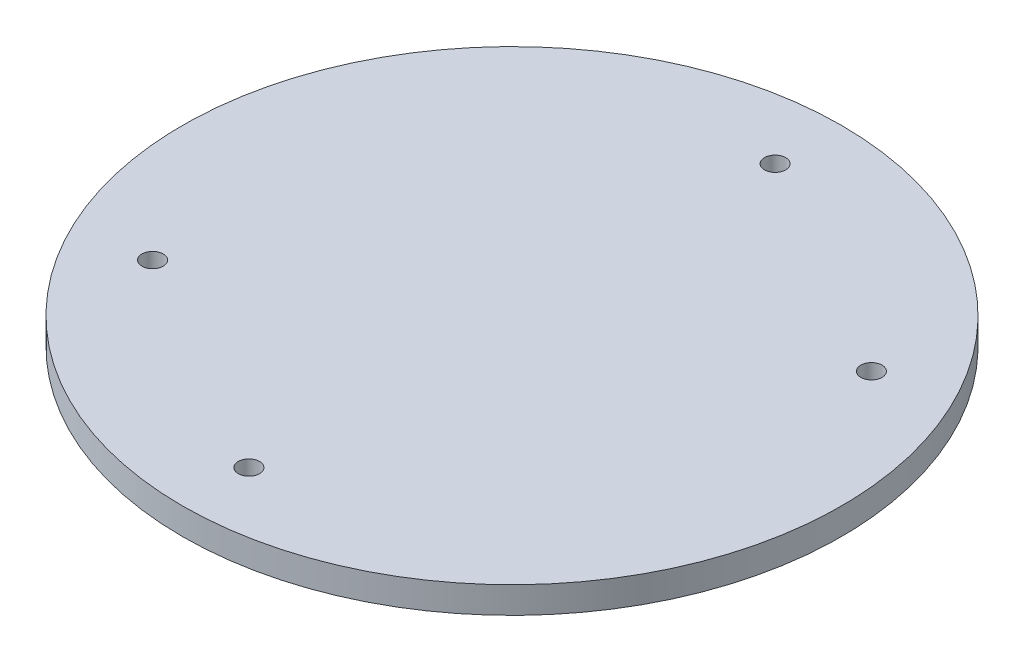
from build123d import *

# Parameters (mm, degrees)
SKETCH1_R               = 62
BOSS_EXTRUDE1_DEPTH     = 5
SKETCH2_R               = 2
CUT_EXTRUDE1_DEPTH      = 5
CIRPATTERN1_COUNT       = 2
CIRPATTERN1_ANGLE       = 120
MIRROR1_COPY_1_SKETCH_R = 2
MIRROR1_COPY_1_DEPTH    = 5


with BuildPart() as part:
    # Sketch1 → Boss-Extrude1 (new body)
    with BuildSketch(Plane(origin=(0, 0, 0), x_dir=(1, 0, 0), z_dir=(0, 1, 0))):
        Circle(SKETCH1_R)
    extrude(amount=BOSS_EXTRUDE1_DEPTH)

    # Sketch2 → Cut-Extrude1 (cut)
    with BuildSketch(Plane(origin=(0, 5, 0), x_dir=(1, 0, 0), z_dir=(0, 1, 0))):
        with Locations((0, 49.5)):
            Circle(SKETCH2_R)
    cut_extrude1 = extrude(amount=-CUT_EXTRUDE1_DEPTH, mode=Mode.SUBTRACT)

    # CirPattern1: Cut-Extrude1 ×2 about axis
    cirpattern1_axis = Axis((0, 5, 0), (0, 1, 0))
    for i in range(1, CIRPATTERN1_COUNT):
        add(cut_extrude1.rotate(cirpattern1_axis, i * CIRPATTERN1_ANGLE / (CIRPATTERN1_COUNT - 1)), mode=Mode.SUBTRACT)

    # Mirror1: Cut-Extrude1 across plane
    add(cut_extrude1.mirror(Plane(origin=(0, 0, 0), x_dir=(-0.49999999999999806, 0, 0.8660254037844398), z_dir=(-0.8660254037844398, 0, -0.49999999999999806))), mode=Mode.SUBTRACT)

    # Mirror1 copy 1 sketch → Mirror1 copy 1 (cut)
    with BuildSketch(Plane(origin=(0, 5, 0), x_dir=(1, 0, 0), z_dir=(0, 1, 0))):
        with Locations((0, -49.5)):
            Circle(MIRROR1_COPY_1_SKETCH_R)
    extrude(amount=-MIRROR1_COPY_1_DEPTH, mode=Mode.SUBTRACT)


solid = part.part
